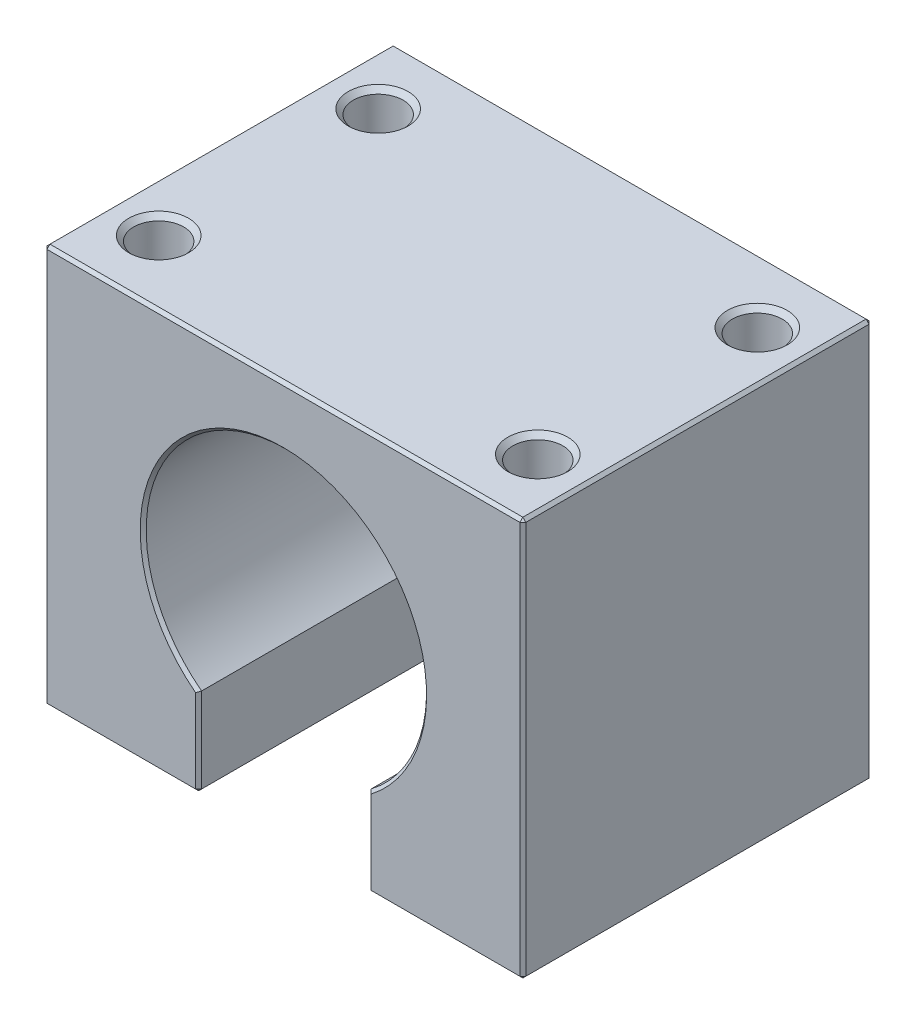
from build123d import *

# Parameters (mm, degrees)
BOSS_EXTRUDE1_DEPTH = 35
CHAMFER2_SIZE       = 0.3
SKETCH2_R           = 2.5
CUT_EXTRUDE1_DEPTH  = 17
SKETCH3_R           = 2.5
CUT_EXTRUDE2_DEPTH  = 20
CHAMFER3_SIZE       = 0.5


with BuildPart() as part:
    # Sketch1 → Boss-Extrude1 (new body)
    with BuildSketch(Plane.XY):
        with BuildLine():
            Line((24, 0), (-24, 0))
            Line((-24, 0), (-24, -40))
            Line((-24, -40), (-8.5, -40))
            Line((-8.5, -40), (-8.5, -31.187157816))
            ThreePointArc((-8.5, -31.187157816), (0, -5.95), (8.5, -31.187157816))
            Line((8.5, -31.187157816), (8.5, -40))
            Line((8.5, -40), (24, -40))
            Line((24, -40), (24, 0))
        make_face()
    extrude(amount=BOSS_EXTRUDE1_DEPTH)

    # Chamfer2
    chamfer2_edges = [part.edges().sort_by_distance(p)[0] for p in [
        (-8.5, -35.593578908, 0),
        (-16.25, -40, 0),
        (16.25, -40, 0),
        (8.5, -35.593578908, 0),
        (-24, -20, 0),
        (-24, -40, 17.5),
        (8.5, -40, 17.5),
        (0, 0, 0),
        (-24, 0, 17.5),
        (-8.5, -40, 17.5),
        (-8.5, -35.593578908, 35),
        (-16.25, -40, 35),
        (-24, -20, 35),
        (8.5, -35.593578908, 35),
        (16.25, -40, 35),
        (24, -40, 17.5),
        (24, -20, 0),
        (24, 0, 17.5),
        (0, 0, 35),
        (24, -20, 35),
        (0, -5.95, 35),
        (0, -5.95, 0),
    ]]
    chamfer(chamfer2_edges, length=CHAMFER2_SIZE)

    # Sketch2 → Cut-Extrude1 (cut)
    with BuildSketch(Plane(origin=(0, 0, 0), x_dir=(1, 0, 0), z_dir=(0, 1, 0))):
        with Locations((-19, -6.5)):
            Circle(SKETCH2_R)
        with Locations((19, -6.5)):
            Circle(SKETCH2_R)
        with Locations((19, -28.5)):
            Circle(SKETCH2_R)
        with Locations((-19, -28.5)):
            Circle(SKETCH2_R)
    extrude(amount=-CUT_EXTRUDE1_DEPTH, mode=Mode.SUBTRACT)

    # Sketch3 → Cut-Extrude2 (cut)
    with BuildSketch(Plane(origin=(0, 0, 0), x_dir=(-1, 0, 0), z_dir=(0, 0, -1))):
        with Locations((-13.435028843, -33.435028843)):
            Circle(SKETCH3_R)
        with Locations((13.435028843, -33.435028843)):
            Circle(SKETCH3_R)
        with Locations((13.435028843, -6.564971157)):
            Circle(SKETCH3_R)
        with Locations((-13.435028843, -6.564971157)):
            Circle(SKETCH3_R)
        with Locations((-19, -20)):
            Circle(SKETCH3_R)
        with Locations((19, -20)):
            Circle(SKETCH3_R)
    extrude(amount=-CUT_EXTRUDE2_DEPTH, mode=Mode.SUBTRACT)

    # Chamfer3
    chamfer3_edges = [part.edges().sort_by_distance(p)[0] for p in [
        (21.5, -20, 0),
        (15.935028843, -33.435028843, 0),
        (-10.935028843, -33.435028843, 0),
        (-16.5, -20, 0),
        (-10.935028843, -6.564971157, 0),
        (16.5, 0, 28.5),
        (16.5, 0, 6.5),
        (-21.5, 0, 28.5),
        (-21.5, 0, 6.5),
    ]]
    chamfer(chamfer3_edges, length=CHAMFER3_SIZE)


solid = part.part
